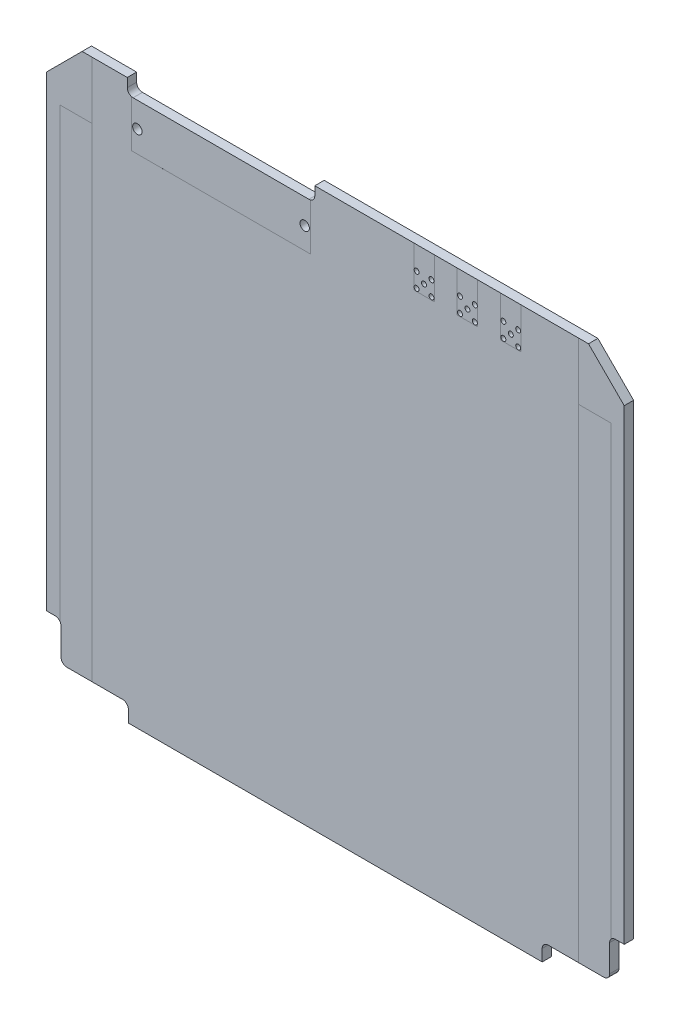
from build123d import *

# Parameters (mm, degrees)
SKETCH1_R            = 0.425
SKETCH1_R_2          = 0.8
BOSS_EXTRUDE1_DEPTH  = 1.6
KEEPOUT_TOP_DEPTH    = 0.0001
KEEPOUT_BOTTOM_DEPTH = 0.0001
PARTFOOTPRINTS_W     = 30.48
PARTFOOTPRINTS_H     = 7.989227112
PARTFOOTPRINTS_W_2   = 3.5
PARTFOOTPRINTS_H_2   = 6.95
FOOTPRINTS_DEPTH     = 0.0001
CAUTION_TOP_START    = -0.00015
CAUTION_TOP_DEPTH    = 0.00015


with BuildPart() as part:
    # Sketch1 → Boss-Extrude1 (new body)
    with BuildSketch(Plane(origin=(0, 0, -0.0125), x_dir=(-1, 0, 0), z_dir=(0, 0, -1))):
        with BuildLine():
            Line((35.3, -50), (35.3, -48))
            ThreePointArc((35.3, -48), (35.592893219, -47.292893219), (36.3, -47))
            Line((36.3, -47), (45.8, -47))
            ThreePointArc((45.8, -47), (46.507106781, -46.707106781), (46.8, -46))
            Line((46.8, -46), (46.8, -41.4))
            ThreePointArc((46.8, -41.4), (47.092893219, -40.692893219), (47.8, -40.4))
            Line((47.8, -40.4), (49.3, -40.4))
            Line((49.3, -40.4), (49.3, 39.2))
            Line((49.3, 39.2), (43.2, 45.3))
            Line((43.2, 45.3), (35.500000002, 45.3))
            Line((35.500000002, 45.3), (35.500000002, 43.8))
            ThreePointArc((35.500000002, 43.8), (35.207106783, 43.092893219), (34.500000002, 42.8))
            Line((34.500000002, 42.8), (4.499999998, 42.8))
            ThreePointArc((4.499999998, 42.8), (3.792893217, 43.092893219), (3.499999998, 43.8))
            Line((3.499999998, 43.8), (3.499999998, 45.3))
            Line((3.499999998, 45.3), (-43.2, 45.3))
            Line((-43.2, 45.3), (-49.3, 39.2))
            Line((-49.3, 39.2), (-49.3, -40.4))
            Line((-49.3, -40.4), (-47.8, -40.4))
            ThreePointArc((-47.8, -40.4), (-47.092893219, -40.692893219), (-46.8, -41.4))
            Line((-46.8, -41.4), (-46.8, -46))
            ThreePointArc((-46.8, -46), (-46.507106781, -46.707106781), (-45.8, -47))
            Line((-45.8, -47), (-36.3, -47))
            ThreePointArc((-36.3, -47), (-35.592893219, -47.292893219), (-35.3, -48))
            Line((-35.3, -48), (-35.3, -50))
            Line((-35.3, -50), (35.3, -50))
        make_face()
        with Locations((-21.27, 41.37)):
            Circle(SKETCH1_R, mode=Mode.SUBTRACT)
        with Locations((-23.81, 41.37)):
            Circle(SKETCH1_R, mode=Mode.SUBTRACT)
        with Locations((-22.54, 40.1)):
            Circle(SKETCH1_R, mode=Mode.SUBTRACT)
        with Locations((-13.87, 41.37)):
            Circle(SKETCH1_R, mode=Mode.SUBTRACT)
        with Locations((-23.81, 38.83)):
            Circle(SKETCH1_R, mode=Mode.SUBTRACT)
        with Locations((-16.41, 41.37)):
            Circle(SKETCH1_R, mode=Mode.SUBTRACT)
        with Locations((-15.14, 40.1)):
            Circle(SKETCH1_R, mode=Mode.SUBTRACT)
        with Locations((-21.27, 38.83)):
            Circle(SKETCH1_R, mode=Mode.SUBTRACT)
        with Locations((-28.67, 41.37)):
            Circle(SKETCH1_R, mode=Mode.SUBTRACT)
        with Locations((-31.21, 41.37)):
            Circle(SKETCH1_R, mode=Mode.SUBTRACT)
        with Locations((-16.41, 38.83)):
            Circle(SKETCH1_R, mode=Mode.SUBTRACT)
        with Locations((-29.94, 40.1)):
            Circle(SKETCH1_R, mode=Mode.SUBTRACT)
        with Locations((-31.21, 38.83)):
            Circle(SKETCH1_R, mode=Mode.SUBTRACT)
        with Locations((-28.67, 38.83)):
            Circle(SKETCH1_R, mode=Mode.SUBTRACT)
        with Locations((33.775, 38.54)):
            Circle(SKETCH1_R_2, mode=Mode.SUBTRACT)
        with Locations((5.225, 38.54)):
            Circle(SKETCH1_R_2, mode=Mode.SUBTRACT)
        with Locations((-13.87, 38.83)):
            Circle(SKETCH1_R, mode=Mode.SUBTRACT)
    extrude(amount=-BOSS_EXTRUDE1_DEPTH)

    # thermalContacts_lower → keepOut_top (cut)
    with BuildSketch(Plane(origin=(0, 0, -0.0125), x_dir=(-1, 0, 0), z_dir=(0, 0, -1))):
        Polygon((47, 35.5), (47, -41.5), (59.827263463, -41.5), (59.827263463, 47), (41.5, 47), (41.5, 41.5), (41.5, 35.5), align=None)
        Polygon((-47, 35.5), (-47, -41.172629575), (-54.178242861, -41.172629575), (-54.178242861, 47.858281552), (-41.5, 47.858281552), (-41.5, 42.552215379), (-41.5, 35.5), align=None)
    extrude(amount=-KEEPOUT_TOP_DEPTH, mode=Mode.SUBTRACT)

    # thermalContacts_upper → keepOut_bottom (cut)
    with BuildSketch(Plane.XY.offset(1.5875)):
        Polygon((-47, 35.5), (-47, -41.5), (-56.192158269, -41.5), (-56.192158269, 47), (-41.5, 47), (-41.5, 41.5), (-41.5, 35.5), align=None)
        Polygon((47, 35.5), (47, -41.5), (59.827263463, -41.5), (59.827263463, 47), (41.5, 47), (41.5, 41.5), (41.5, 35.5), align=None)
    extrude(amount=-KEEPOUT_BOTTOM_DEPTH, mode=Mode.SUBTRACT)

    # partFootprints → footPrints (cut)
    with BuildSketch(Plane.XY.offset(1.5875)):
        with Locations((-19.5, 38.834613556)):
            Rectangle(PARTFOOTPRINTS_W, PARTFOOTPRINTS_H)
        with Locations((15.14, 41.825)):
            Rectangle(PARTFOOTPRINTS_W_2, PARTFOOTPRINTS_H_2)
        with Locations((22.54, 41.825)):
            Rectangle(PARTFOOTPRINTS_W_2, PARTFOOTPRINTS_H_2)
        with Locations((29.94, 41.825)):
            Rectangle(PARTFOOTPRINTS_W_2, PARTFOOTPRINTS_H_2)
    extrude(amount=-FOOTPRINTS_DEPTH, mode=Mode.SUBTRACT)

    # Sketch3 → caution_top (cut)
    with BuildSketch(Plane.XY.offset(1.5875).offset(CAUTION_TOP_START)):
        with BuildLine():
            Line((41.5, -47), (41.5, 35.5))
            Line((41.5, 35.5), (47, 35.5))
            Line((47, 35.5), (47, -40.8))
            ThreePointArc((47, -40.8), (46.851316702, -41.083772234), (46.8, -41.4))
            Line((46.8, -41.4), (46.8, -46))
            ThreePointArc((46.8, -46), (46.507106781, -46.707106781), (45.8, -47))
            Line((45.8, -47), (41.5, -47))
        make_face()
        with BuildLine():
            Line((-41.5, 35.5), (-47, 35.5))
            Line((-47, 35.5), (-47, -40.8))
            ThreePointArc((-47, -40.8), (-46.851316702, -41.083772234), (-46.8, -41.4))
            Line((-46.8, -41.4), (-46.8, -46))
            ThreePointArc((-46.8, -46), (-46.507106781, -46.707106781), (-45.8, -47))
            Line((-45.8, -47), (-41.5, -47))
            Line((-41.5, -47), (-41.5, 35.5))
        make_face()
    caution_top = extrude(amount=CAUTION_TOP_DEPTH, mode=Mode.SUBTRACT)

    # caution_bottom: caution_top across plane
    add(caution_top.mirror(Plane.XY.offset(0.7875)), mode=Mode.SUBTRACT)


solid = part.part
